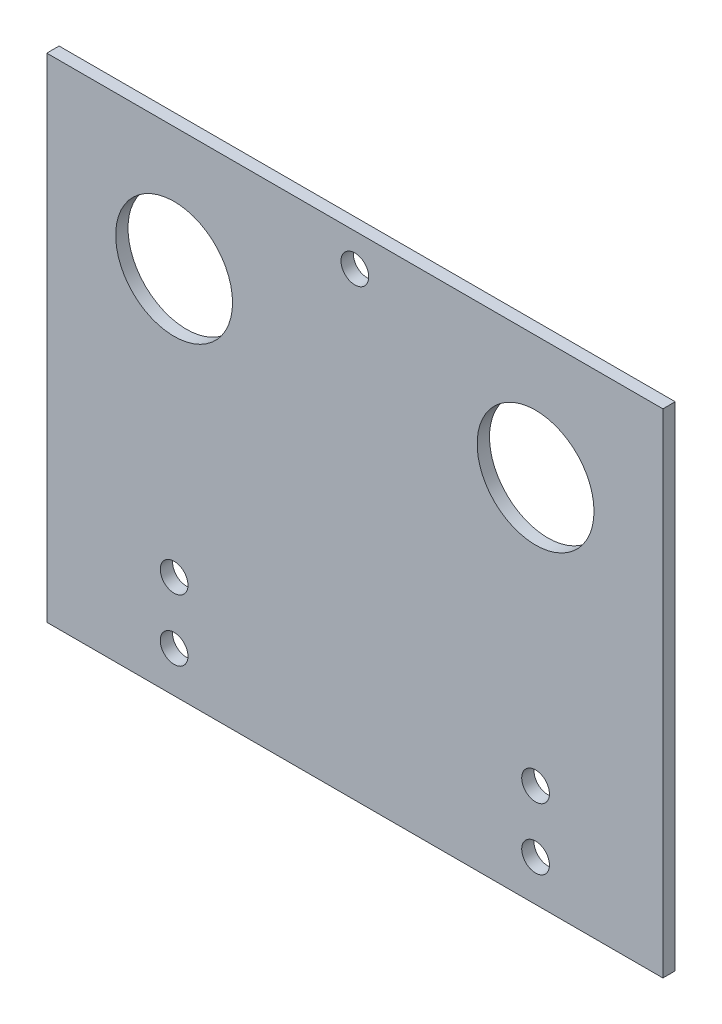
from build123d import *

# Parameters (mm, degrees)
SKETCH1_W           = 150
SKETCH1_H           = 120
BOSS_EXTRUDE1_DEPTH = 3
SKETCH2_R           = 14.225
SKETCH2_R_2         = 3.375
CUT_EXTRUDE1_DEPTH  = 193.117151759


with BuildPart() as part:
    # Sketch1 → Boss-Extrude1 (new body)
    with BuildSketch(Plane.XY):
        with Locations((75, -60)):
            Rectangle(SKETCH1_W, SKETCH1_H)
    extrude(amount=BOSS_EXTRUDE1_DEPTH)

    # Sketch2 → Cut-Extrude1 (cut, through all)
    with BuildSketch(Plane.XY.offset(3)):
        with Locations((31, -30)):
            Circle(SKETCH2_R)
        with Locations((119, -30)):
            Circle(SKETCH2_R)
        with Locations((31, -110)):
            Circle(SKETCH2_R_2)
        with Locations((119, -110)):
            Circle(SKETCH2_R_2)
        with Locations((75, -8)):
            Circle(SKETCH2_R_2)
        with Locations((31, -95)):
            Circle(SKETCH2_R_2)
        with Locations((119, -95)):
            Circle(SKETCH2_R_2)
    extrude(amount=-CUT_EXTRUDE1_DEPTH, mode=Mode.SUBTRACT)


solid = part.part
